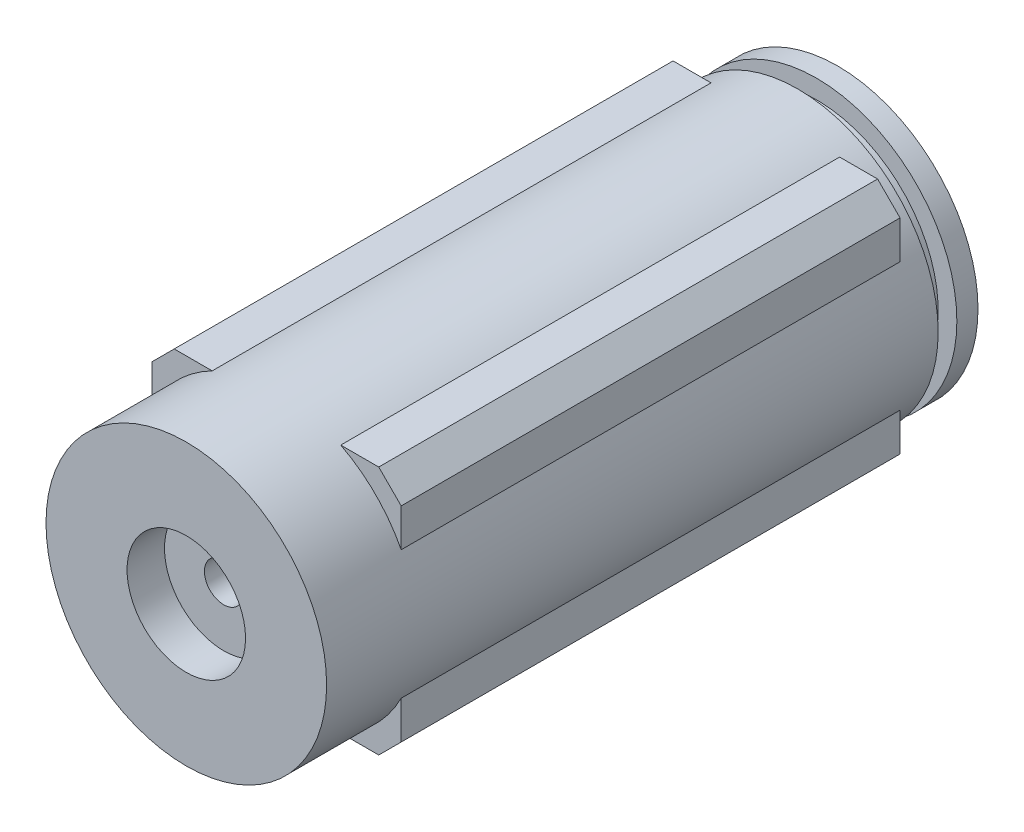
from build123d import *
from build123d.topology import SkipClean

# Parameters (mm, degrees)
EXTRUDE_1_DEPTH     = 80
EXTRUDE_START       = 10
SKETCH_4_R          = 22.5
EXTRUDE_2_DEPTH     = 10
SKETCH_6_R          = 22.5
EXTRUDE_3_DEPTH     = 14.46
CUT_EXTRUDE_START   = -3.39
SKETCH_7_R          = 22.5
SKETCH_7_R_2        = 19.5
CUT_EXTRUDE_4_DEPTH = 3
SKETCH_13_R         = 3.1
CUT_EXTRUDE_5_DEPTH = 100
SKETCH_14_R         = 9.5
CUT_EXTRUDE_6_DEPTH = 6
CUT_EXTRUDE_START_2 = -6
SKETCH_15_R         = 9.5
CUT_EXTRUDE_7_DEPTH = 6


with BuildPart() as part:
    # 草图1 → 凸台-拉伸1 (new body)
    with BuildSketch(Plane.XY):
        with BuildLine():
            Line((-16.4, 20), (-10.307764064, 20))
            ThreePointArc((-10.307764064, 20), (0, 22.5), (10.307764064, 20))
            Line((10.307764064, 20), (16.4, 20))
            Line((16.4, 20), (20, 16.4))
            Line((20, 16.4), (20, 10.307764064))
            ThreePointArc((20, 10.307764064), (22.5, 0), (20, -10.307764064))
            Line((20, -10.307764064), (20, -16.4))
            Line((20, -16.4), (16.4, -20))
            Line((16.4, -20), (10.307764064, -20))
            ThreePointArc((10.307764064, -20), (0, -22.5), (-10.307764064, -20))
            Line((-10.307764064, -20), (-16.4, -20))
            Line((-16.4, -20), (-20, -16.4))
            Line((-20, -16.4), (-20, -10.307764064))
            ThreePointArc((-20, -10.307764064), (-22.5, 0), (-20, 10.307764064))
            Line((-20, 10.307764064), (-20, 16.4))
            Line((-20, 16.4), (-16.4, 20))
        make_face()
    extrude(amount=EXTRUDE_1_DEPTH)

    # 草图4 → 凸台-拉伸2 (add)
    with BuildSketch(Plane(origin=(0, 0, 0), x_dir=(-1, 0, 0), z_dir=(0, 0, -1)).offset(EXTRUDE_START)):
        Circle(SKETCH_4_R)
    extrude(amount=-EXTRUDE_2_DEPTH)

    # 草图6 → 凸台-拉伸3 (add)
    with SkipClean():  # the faces are left unmerged after this step: merging them gives an invalid solid
        with BuildSketch(Plane.XY.offset(80)):
            Circle(SKETCH_6_R)
        extrude(amount=EXTRUDE_3_DEPTH)

    # 草图7 → 切除-拉伸4 (cut)
    with SkipClean():  # the faces are left unmerged after this step: merging them gives an invalid solid
        with BuildSketch(Plane(origin=(0, 0, -10), x_dir=(-1, 0, 0), z_dir=(0, 0, -1)).offset(CUT_EXTRUDE_START)):
            Circle(SKETCH_7_R)
            Circle(SKETCH_7_R_2, mode=Mode.SUBTRACT)
        extrude(amount=-CUT_EXTRUDE_4_DEPTH, mode=Mode.SUBTRACT)

    # 草图13 → 切除-拉伸5 (cut)
    with SkipClean():  # the faces are left unmerged after this step: merging them gives an invalid solid
        with BuildSketch(Plane(origin=(0, 0, -10), x_dir=(-1, 0, 0), z_dir=(0, 0, -1))):
            Circle(SKETCH_13_R)
        extrude(amount=-CUT_EXTRUDE_5_DEPTH, mode=Mode.SUBTRACT)

    # 草图14 → 切除-拉伸6 (cut)
    with SkipClean():  # the faces are left unmerged after this step: merging them gives an invalid solid
        with BuildSketch(Plane(origin=(0, 0, -10), x_dir=(-1, 0, 0), z_dir=(0, 0, -1))):
            Circle(SKETCH_14_R)
        extrude(amount=-CUT_EXTRUDE_6_DEPTH, mode=Mode.SUBTRACT)

    # 草图15 → 切除-拉伸7 (cut)
    with SkipClean():  # the faces are left unmerged after this step: merging them gives an invalid solid
        with BuildSketch(Plane.XY.offset(94.46).offset(CUT_EXTRUDE_START_2)):
            Circle(SKETCH_15_R)
        extrude(amount=CUT_EXTRUDE_7_DEPTH, mode=Mode.SUBTRACT)


solid = part.part
